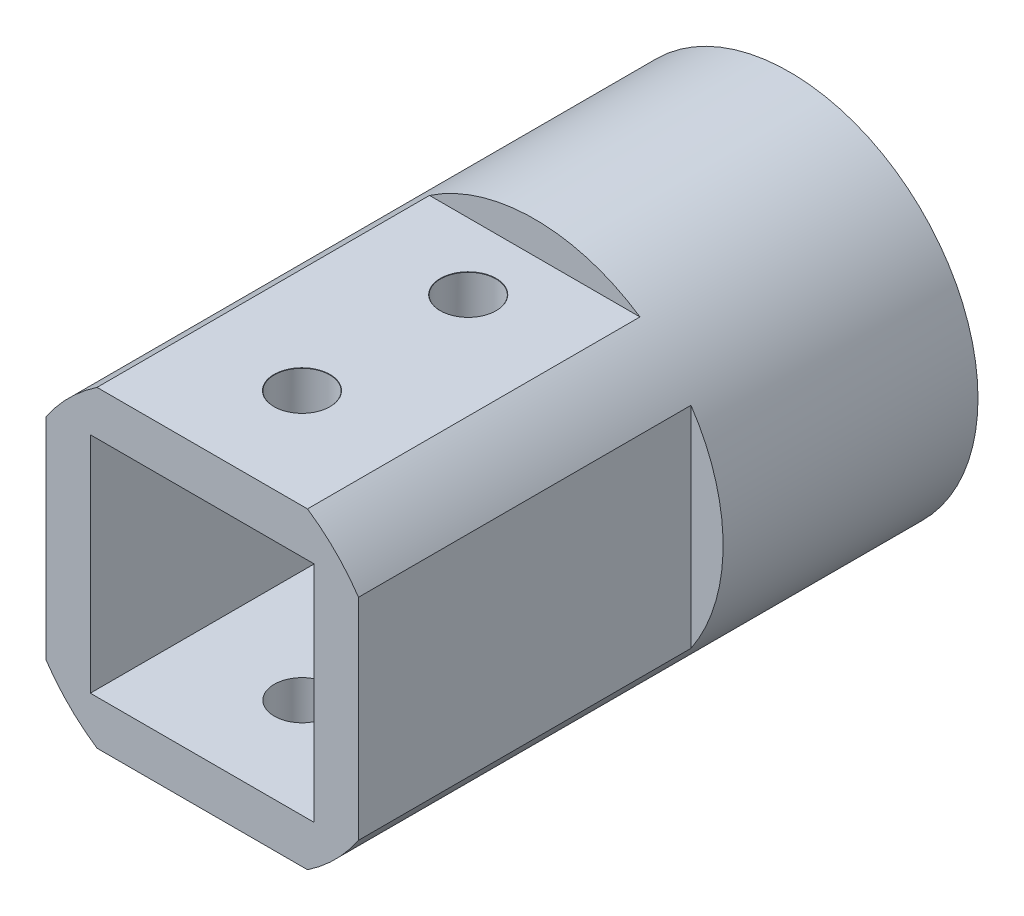
from build123d import *

# Parameters (mm, degrees)
SKETCH_1_R            = 17
EXTRUDE_1_DEPTH       = 3
SKETCH_2_R            = 17
SKETCH_2_R_2          = 15
EXTRUDE_2_DEPTH       = 10
SKETCH_3_R            = 5
CUT_EXTRUDE_1_DEPTH   = 27.038433133
SKETCH_4_R            = 17
EXTRUDE_3_DEPTH       = 10
SKETCH_5_W            = 20.2
SKETCH_5_H            = 20.2
EXTRUDE_4_DEPTH       = 30
F_5_0MM_1_D           = 5
F_5_0MM_1_CSINK_D     = 5.05
F_5_0MM_1_CSINK_ANGLE = 90
F_2_5MM_1_D           = 2.5
F_2_5MM_1_CSINK_D     = 2.55
F_2_5MM_1_CSINK_ANGLE = 90


with BuildPart() as part:
    # 草图1 → 凸台-拉伸1 (new body)
    with BuildSketch(Plane.XY):
        Circle(SKETCH_1_R)
    extrude(amount=EXTRUDE_1_DEPTH)

    # 草图2 → 凸台-拉伸2 (add)
    with BuildSketch(Plane.XY.offset(3)):
        Circle(SKETCH_2_R)
        Circle(SKETCH_2_R_2, mode=Mode.SUBTRACT)
    extrude(amount=EXTRUDE_2_DEPTH)

    # 草图3 → 切除-拉伸1 (cut, through all)
    with BuildSketch(Plane.XY.offset(3)):
        Circle(SKETCH_3_R)
    extrude(amount=-CUT_EXTRUDE_1_DEPTH, mode=Mode.SUBTRACT)

    # 草图4 → 凸台-拉伸3 (add)
    with BuildSketch(Plane.XY.offset(13)):
        Circle(SKETCH_4_R)
        Polygon((-4.443145751, 10.1), (4.443145751, 10.1), (10.1, 4.443145751), (10.1, -4.443145751), (4.443145751, -10.1), (-4.443145751, -10.1), (-10.1, -4.443145751), (-10.1, 4.443145751), align=None, mode=Mode.SUBTRACT)
    extrude(amount=EXTRUDE_3_DEPTH)

    # 草图5 → 凸台-拉伸4 (add)
    with BuildSketch(Plane.XY.offset(23)):
        with BuildLine():
            Line((9.49684158, 14.1), (-9.49684158, 14.1))
            ThreePointArc((-9.49684158, 14.1), (-12.02081528, 12.02081528), (-14.1, 9.49684158))
            Line((-14.1, 9.49684158), (-14.1, -9.496842588))
            ThreePointArc((-14.1, -9.496842588), (-12.020815678, -12.020815678), (-9.496842588, -14.1))
            Line((-9.496842588, -14.1), (9.49684158, -14.1))
            ThreePointArc((9.49684158, -14.1), (12.02081528, -12.02081528), (14.1, -9.49684158))
            Line((14.1, -9.49684158), (14.1, 9.49684158))
            ThreePointArc((14.1, 9.49684158), (12.02081528, 12.02081528), (9.49684158, 14.1))
        make_face()
        Rectangle(SKETCH_5_W, SKETCH_5_H, mode=Mode.SUBTRACT)
    extrude(amount=EXTRUDE_4_DEPTH)

    # Ø5.0mm 暗销孔1 (through all)
    with Locations(Plane(origin=(0, 14.1, 0), x_dir=(1, 0, 0), z_dir=(0, 1, 0))):
        with Locations((0, -29), (0, -44)):
            CounterSinkHole(F_5_0MM_1_D / 2, F_5_0MM_1_CSINK_D / 2, counter_sink_angle=F_5_0MM_1_CSINK_ANGLE)

    # Ø2.5mm 暗销孔1 (through all)
    with Locations(Plane.XY.offset(3)):
        with Locations((0, 8), (8, 0), (0, -8), (-8, 0)):
            CounterSinkHole(F_2_5MM_1_D / 2, F_2_5MM_1_CSINK_D / 2, counter_sink_angle=F_2_5MM_1_CSINK_ANGLE)


solid = part.part
